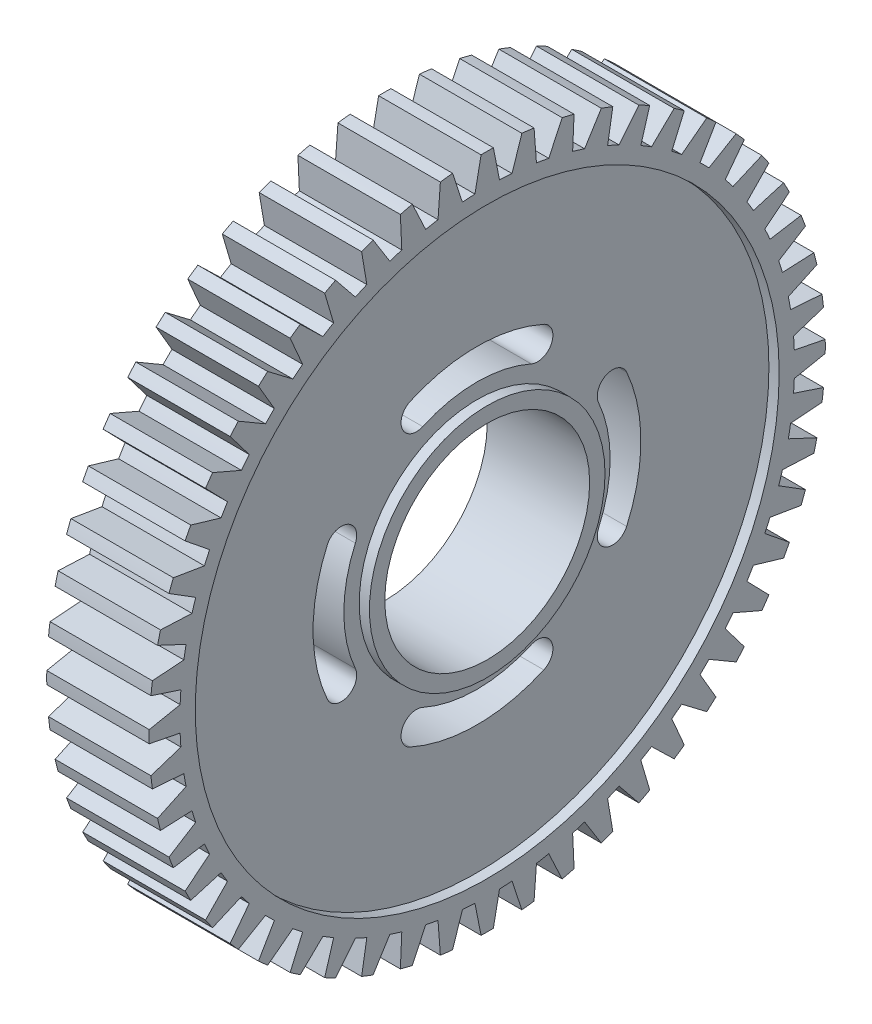
from build123d import *

# Parameters (mm, degrees)
SKETCH1_R           = 28.5
SKETCH1_R_2         = 11.5
BOSS_EXTRUDE1_DEPTH = 4
SKETCH1_3_R         = 28.5
SKETCH1_3_R_2       = 11.5
SKETCH1_3_R_3       = 10
BOSS_EXTRUDE2_DEPTH = 5
BOSS_EXTRUDE3_DEPTH = 5
CIRPATTERN1_COUNT   = 52
CUT_EXTRUDE2_DEPTH  = 47.936126811
FILLET1_START       = -4
FILLET1_DEPTH       = 8
FILLET2_START       = -4
FILLET2_DEPTH       = 8
CIRPATTERN2_COUNT   = 4


with BuildPart() as part:
    # Sketch1 → Boss-Extrude1 (new, symmetric)
    with BuildSketch(Plane.YZ):
        with Locations(Location((0, 0, 0), (0, 0, 270))):
            Circle(SKETCH1_R)
        with Locations(Location((0, 0, 0), (0, 0, 270))):
            Circle(SKETCH1_R_2, mode=Mode.SUBTRACT)
    extrude(amount=BOSS_EXTRUDE1_DEPTH, both=True)

    # Sketch1<3> → Boss-Extrude2 (add, symmetric)
    # profile 1 of 2: a face of its own
    with BuildSketch(Plane.YZ):
        with BuildLine():
            ThreePointArc((32.994544183, -0.600045126), (33, -4.5133e-05), (32.994545824, 0.599954874))
            Line((32.994545824, 0.599954874), (29.975992033, 1.199959003))
            ThreePointArc((29.975992033, 1.199959003), (-30, 4.103e-05), (29.975988751, -1.200040997))
            Line((29.975988751, -1.200040997), (32.994544183, -0.600045126))
        make_face()
        with Locations(Location((0, 0, 0), (0, 0, 270))):
            Circle(SKETCH1_3_R, mode=Mode.SUBTRACT)
    # profile 2 of 2: a face of its own
    with BuildSketch(Plane.YZ):
        with Locations(Location((0, 0, 0), (0, 0, 270))):
            Circle(SKETCH1_3_R_2)
        with Locations(Location((0, 0, 0), (0, 0, 270))):
            Circle(SKETCH1_3_R_3, mode=Mode.SUBTRACT)
    extrude(amount=BOSS_EXTRUDE2_DEPTH, both=True)

    # Sketch1<4> → Boss-Extrude3 (add, symmetric)
    with BuildSketch(Plane.YZ):
        with BuildLine():
            ThreePointArc((32.994544183, -0.600045126), (33, -4.5133e-05), (32.994545824, 0.599954874))
            Line((32.994545824, 0.599954874), (29.975992033, 1.199959003))
            ThreePointArc((29.975992033, 1.199959003), (29.993997408, 0.600099573), (30, 0))
            ThreePointArc((30, 0), (29.993996587, -0.600140595), (29.975988751, -1.200040997))
            Line((29.975988751, -1.200040997), (32.994544183, -0.600045126))
        make_face()
    boss_extrude3 = extrude(amount=BOSS_EXTRUDE3_DEPTH, both=True)

    # CirPattern1: Boss-Extrude3 ×52 about axis
    cirpattern1_axis = Axis((0, 0, 0), (1, 0, 0))
    for i in range(1, CIRPATTERN1_COUNT):
        add(boss_extrude3.rotate(cirpattern1_axis, i * 360 / CIRPATTERN1_COUNT))

    # Sketch1<6> → Cut-Extrude2 (cut, symmetric)
    with BuildSketch(Plane.YZ):
        with BuildLine():
            ThreePointArc((-6.5, 11.258330249), (0, 13), (6.5, 11.258330249))
            Line((6.5, 11.258330249), (8, 13.856406461))
            ThreePointArc((8, 13.856406461), (0, 16), (-8, 13.856406461))
            Line((-8, 13.856406461), (-6.5, 11.258330249))
        make_face()
    cut_extrude2 = extrude(amount=CUT_EXTRUDE2_DEPTH, both=True, mode=Mode.SUBTRACT)

    # Fillet1: read off the stored shape, not the designer's step
    # Fillet1 outline → Fillet1 (add)
    with BuildSketch(Plane.YZ.offset(FILLET1_START)):
        with BuildLine():
            ThreePointArc((-6.5, 11.258330249), (-5.908165679, 11.579878165), (-5.300471571, 11.870341239))
            add(Edge.make_bspline(
                [(-5.300471571, 11.870341239), (-5.62097103, 11.727228396), (-6.029597703, 11.655683844), (-6.496578351, 11.727639411), (-6.932882302, 12.008104397), (-7.211102546, 12.489995989)],
                knots=[0, 0, 0, 0, 0, 0, 0.474068366, 0.474068366, 0.474068366, 0.474068366, 0.474068366, 0.474068366], degree=5, weights=[1, 0.810372654, 0.66569347, 0.56596245, 0.511179593, 0.501344899]))
            Line((-7.211102546, 12.489995989), (-6.5, 11.258330249))
        make_face()
        with BuildLine():
            Line((-8, 13.856406461), (-7.211102546, 12.489995989))
            add(Edge.make_bspline(
                [(-7.211102546, 12.489995989), (-7.532816375, 13.047220679), (-7.525071781, 13.652742597), (-7.259064797, 14.138057651), (-6.888560975, 14.446710077), (-6.523657318, 14.609650755)],
                knots=[0.474068366, 0.474068366, 0.474068366, 0.474068366, 0.474068366, 0.474068366, 1, 1, 1, 1, 1, 1], degree=5, weights=[0.501344899, 0.490434286, 0.534844489, 0.634575509, 0.789627346, 1]))
            ThreePointArc((-6.523657318, 14.609650755), (-7.271588528, 14.252157742), (-8, 13.856406461))
        make_face()
    fillet1 = extrude(amount=FILLET1_DEPTH)

    # Fillet2: read off the stored shape, not the designer's step
    # Fillet2 outline → Fillet2 (add)
    with BuildSketch(Plane.YZ.offset(FILLET2_START)):
        with BuildLine():
            ThreePointArc((8, 13.856406461), (7.271588528, 14.252157742), (6.523657319, 14.609650756))
            add(Edge.make_bspline(
                [(6.523657319, 14.609650756), (6.888562857, 14.446709236), (7.259068551, 14.138054524), (7.525075636, 13.652735564), (7.532816513, 13.047209924), (7.21109614, 12.489984893)],
                knots=[0, 0, 0, 0, 0, 0, 0.525933775, 0.525933775, 0.525933775, 0.525933775, 0.525933775, 0.525933775], degree=5, weights=[1, 0.78962649, 0.634574247, 0.534843271, 0.490433563, 0.501345121]))
            Line((7.21109614, 12.489984893), (8, 13.856406461))
        make_face()
        with BuildLine():
            Line((6.5, 11.258330249), (7.21109614, 12.489984893))
            add(Edge.make_bspline(
                [(7.21109614, 12.489984893), (6.932873575, 12.008098787), (6.496570908, 11.727638264), (6.02959321, 11.655684631), (5.620969244, 11.727229194), (5.300471572, 11.870341239)],
                knots=[0.525933775, 0.525933775, 0.525933775, 0.525933775, 0.525933775, 0.525933775, 1, 1, 1, 1, 1, 1], degree=5, weights=[0.501345121, 0.511180583, 0.565963802, 0.665694777, 0.81037351, 1]))
            ThreePointArc((5.300471572, 11.870341239), (5.908165679, 11.579878165), (6.5, 11.258330249))
        make_face()
    fillet2 = extrude(amount=FILLET2_DEPTH)

    # CirPattern2: Cut-Extrude2, Fillet1, Fillet2 ×4 about axis
    cirpattern2_axis = Axis((4, 0, 0), (1, 0, 0))
    add([cut_extrude2.rotate(cirpattern2_axis, i * 360 / CIRPATTERN2_COUNT) for i in range(1, CIRPATTERN2_COUNT)], mode=Mode.SUBTRACT)
    add([fillet1.rotate(cirpattern2_axis, i * 360 / CIRPATTERN2_COUNT) for i in range(1, CIRPATTERN2_COUNT)])
    add([fillet2.rotate(cirpattern2_axis, i * 360 / CIRPATTERN2_COUNT) for i in range(1, CIRPATTERN2_COUNT)])


solid = part.part
